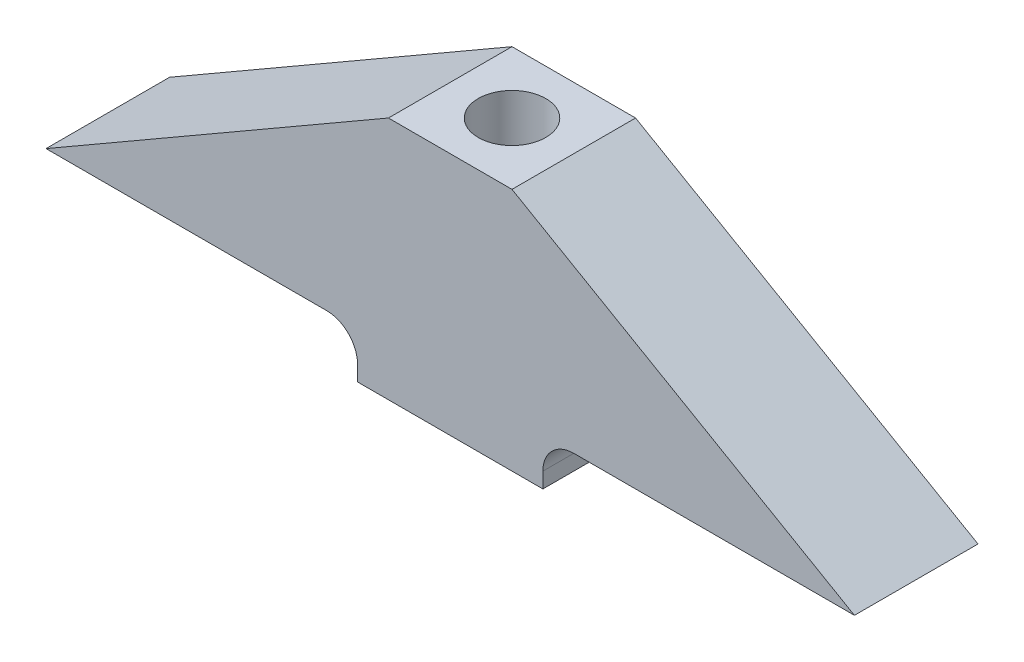
from build123d import *

# Parameters (mm, degrees)
BOSS_EXTRUDE1_DEPTH                  = 25.4
F_35_64_0_54688_DIAMETER_HOLE1_D     = 13.890752
F_35_64_0_54688_DIAMETER_HOLE1_DEPTH = 35.052
F_35_64_0_54688_DIAMETER_HOLE1_TIP   = 4.173202923
F_1_4_28_TAPPED_HOLE1_D              = 5.4102
F_1_4_28_TAPPED_HOLE1_DEPTH          = 9.144
F_1_4_28_TAPPED_HOLE1_TIP            = 1.625388061
FILLET1_R                            = 6.35


with BuildPart() as part:
    # Sketch1 → Boss-Extrude1 (new body)
    with BuildSketch(Plane.XY):
        Polygon((0, 0), (64.04054482, 0), (64.04054482, -9.525), (102.14054482, -9.525), (102.14054482, 0), (166.181089639, 0), (95.79054482, 40.64), (70.39054482, 40.64), align=None)
    extrude(amount=BOSS_EXTRUDE1_DEPTH)

    # 35/64 (0.54688) Diameter Hole1
    with Locations(Plane(origin=(0, 40.64, 0), x_dir=(1, 0, 0), z_dir=(0, 1, 0))):
        with Locations((83.09054482, -12.7)):
            Hole(F_35_64_0_54688_DIAMETER_HOLE1_D / 2, depth=F_35_64_0_54688_DIAMETER_HOLE1_DEPTH)
            with Locations((0, 0, -(F_35_64_0_54688_DIAMETER_HOLE1_DEPTH + F_35_64_0_54688_DIAMETER_HOLE1_TIP / 2))):  # 118° drill point
                Cone(0, F_35_64_0_54688_DIAMETER_HOLE1_D / 2, F_35_64_0_54688_DIAMETER_HOLE1_TIP, mode=Mode.SUBTRACT)

    # 1/4-28 Tapped Hole1
    with Locations(Plane(origin=(0, -9.525, 0), x_dir=(-1, 0, 0), z_dir=(0, -1, 0))):
        with Locations((-92.61554482, -15.875), (-73.56554482, -9.525)):
            Hole(F_1_4_28_TAPPED_HOLE1_D / 2, depth=F_1_4_28_TAPPED_HOLE1_DEPTH)
            with Locations((0, 0, -(F_1_4_28_TAPPED_HOLE1_DEPTH + F_1_4_28_TAPPED_HOLE1_TIP / 2))):  # 118° drill point
                Cone(0, F_1_4_28_TAPPED_HOLE1_D / 2, F_1_4_28_TAPPED_HOLE1_TIP, mode=Mode.SUBTRACT)

    # Fillet1
    fillet1_edges = [part.edges().sort_by_distance(p)[0] for p in [
        (102.14054482, 0, 12.7),
        (64.04054482, 0, 12.7),
    ]]
    fillet(fillet1_edges, radius=FILLET1_R)


solid = part.part
